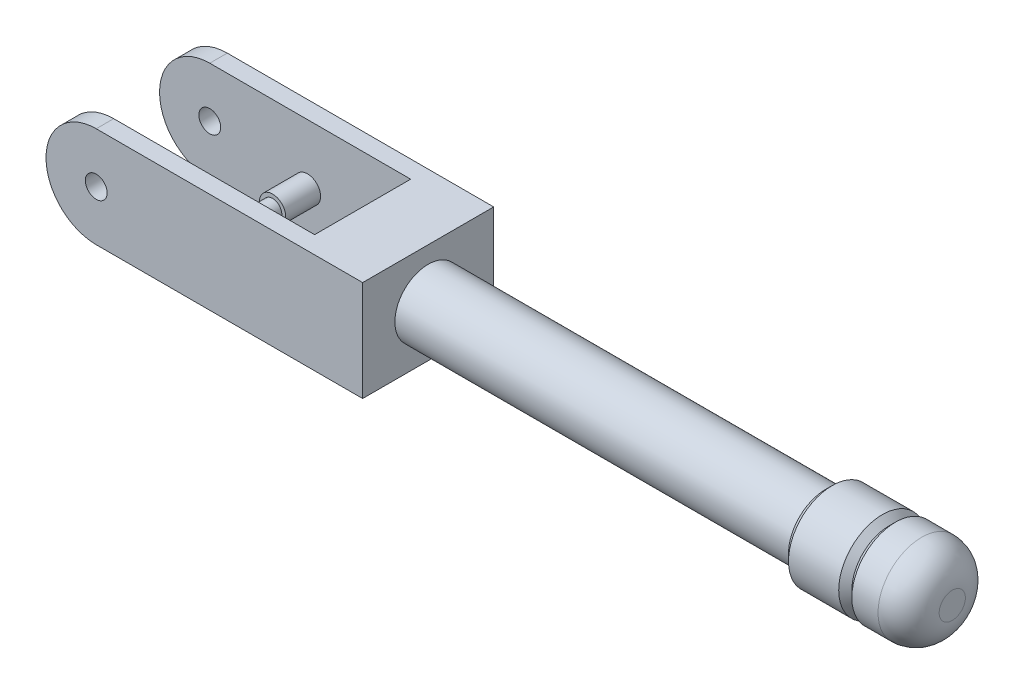
from build123d import *

# Parameters (mm, degrees)
SALIENTE_EXTRUIR1_DEPTH = 60
CORTAR_EXTRUIR1_REACH   = 135.791
CROQUIS3_W              = 115.000008821
CROQUIS3_H              = 44
CROQUIS6_R              = 6
SALIENTE_EXTRUIR4_DEPTH = 16
CROQUIS7_R              = 4.25
SALIENTE_EXTRUIR5_DEPTH = 12
SALIENTE_EXTRUIR6_REACH = 131.263
CROQUIS8_R              = 6
CROQUIS9_R              = 15.25
SALIENTE_EXTRUIR7_DEPTH = 182
CROQUIS10_R             = 20
SALIENTE_EXTRUIR8_DEPTH = 29
CHAFL_N1_SIZE           = 3
CHAFL_N2_SIZE           = 3
CROQUIS11_R             = 20
SALIENTE_EXTRUIR9_DEPTH = 29
CHAFL_N3_SIZE           = 3
REDONDEO1_R             = 14
CROQUIS12_R             = 5
CORTAR_EXTRUIR2_DEPTH   = 368.658817909


with BuildPart() as part:
    # Croquis1 → Saliente-Extruir1 (new body)
    with BuildSketch(Plane.XY.offset(30)):
        with BuildLine():
            Line((122.000008821, -23), (122.000008821, 23))
            Line((122.000008821, 23), (0, 23))
            ThreePointArc((0, 23), (-23, 0), (0, -23))
            Line((0, -23), (122.000008821, -23))
        make_face()
    extrude(amount=-SALIENTE_EXTRUIR1_DEPTH)

    # Croquis3 → Cortar-Extruir1 (cut, up to next)
    with BuildSketch(Plane(origin=(0, 23, 0), x_dir=(1, 0, 0), z_dir=(0, 1, 0)), mode=Mode.PRIVATE) as cortar_extruir1_sk1:
        with Locations((34.500004411, 0)):
            Rectangle(CROQUIS3_W, CROQUIS3_H)
    cortar_extruir1_tool1 = extrude(cortar_extruir1_sk1.sketch, amount=-CORTAR_EXTRUIR1_REACH, mode=Mode.PRIVATE) & part.part
    add(cortar_extruir1_tool1.solids().sort_by_distance((34.500004, 23, 0))[0], mode=Mode.SUBTRACT)

    # Croquis6 → Saliente-Extruir4 (add)
    with BuildSketch(Plane.XY.offset(-22)):
        with Locations(Location((44.750008821, -4.5, 0), (0, 0, 180))):
            Circle(CROQUIS6_R)
    extrude(amount=SALIENTE_EXTRUIR4_DEPTH)

    # Croquis7 → Saliente-Extruir5 (add)
    with BuildSketch(Plane.XY.offset(-6)):
        with Locations((44.750008821, -4.5)):
            Circle(CROQUIS7_R)
    extrude(amount=SALIENTE_EXTRUIR5_DEPTH)

    # Croquis8 → Saliente-Extruir6 (add, up to next)
    with BuildSketch(Plane.XY.offset(6), mode=Mode.PRIVATE) as saliente_extruir6_sk1:
        with Locations(Location((44.750008821, -4.5, 0), (0, 0, 180))):
            Circle(CROQUIS8_R)
    saliente_extruir6_tool1 = extrude(saliente_extruir6_sk1.sketch, amount=SALIENTE_EXTRUIR6_REACH, mode=Mode.PRIVATE) - part.part
    add(saliente_extruir6_tool1.solids().sort_by_distance((44.750009, -4.5, 6))[0])

    # Croquis9 → Saliente-Extruir7 (add)
    with BuildSketch(Plane(origin=(122.000008821, 0, 0), x_dir=(0, 0, -1), z_dir=(1, 0, 0))):
        Circle(CROQUIS9_R)
    extrude(amount=SALIENTE_EXTRUIR7_DEPTH)

    # Croquis10 → Saliente-Extruir8 (add)
    with BuildSketch(Plane(origin=(304.000008821, 0, 0), x_dir=(0, 0, -1), z_dir=(1, 0, 0))):
        with Locations(Location((0, 0, 0), (0, 0, 180))):
            Circle(CROQUIS10_R)
    extrude(amount=SALIENTE_EXTRUIR8_DEPTH)

    # Chaflán1
    chafl_n1_edges = [part.edges().sort_by_distance(p)[0] for p in [
        (304.000008821, 0, -20),
    ]]
    chamfer(chafl_n1_edges, length=CHAFL_N1_SIZE)

    # Chaflán2
    chafl_n2_edges = [part.edges().sort_by_distance(p)[0] for p in [
        (333.000008821, 0, -20),
    ]]
    chamfer(chafl_n2_edges, length=CHAFL_N2_SIZE)

    # Croquis11 → Saliente-Extruir9 (add)
    with BuildSketch(Plane(origin=(333.000008821, 0, 0), x_dir=(0, 0, -1), z_dir=(1, 0, 0))):
        with Locations(Location((0, 0, 0), (0, 0, 180))):
            Circle(CROQUIS11_R)
    extrude(amount=SALIENTE_EXTRUIR9_DEPTH)

    # Chaflán3
    chafl_n3_edges = [part.edges().sort_by_distance(p)[0] for p in [
        (333.000008821, 0, -20),
    ]]
    chamfer(chafl_n3_edges, length=CHAFL_N3_SIZE - 0.0001)  # a hair under: the kernel refuses the full size

    # Redondeo1
    redondeo1_edges = [part.edges().sort_by_distance(p)[0] for p in [
        (362.000008821, 0, -20),
    ]]
    fillet(redondeo1_edges, radius=REDONDEO1_R)

    # Croquis12 → Cortar-Extruir2 (cut, through all)
    with BuildSketch(Plane.XY.offset(30)):
        Circle(CROQUIS12_R)
    extrude(amount=-CORTAR_EXTRUIR2_DEPTH, mode=Mode.SUBTRACT)


solid = part.part
